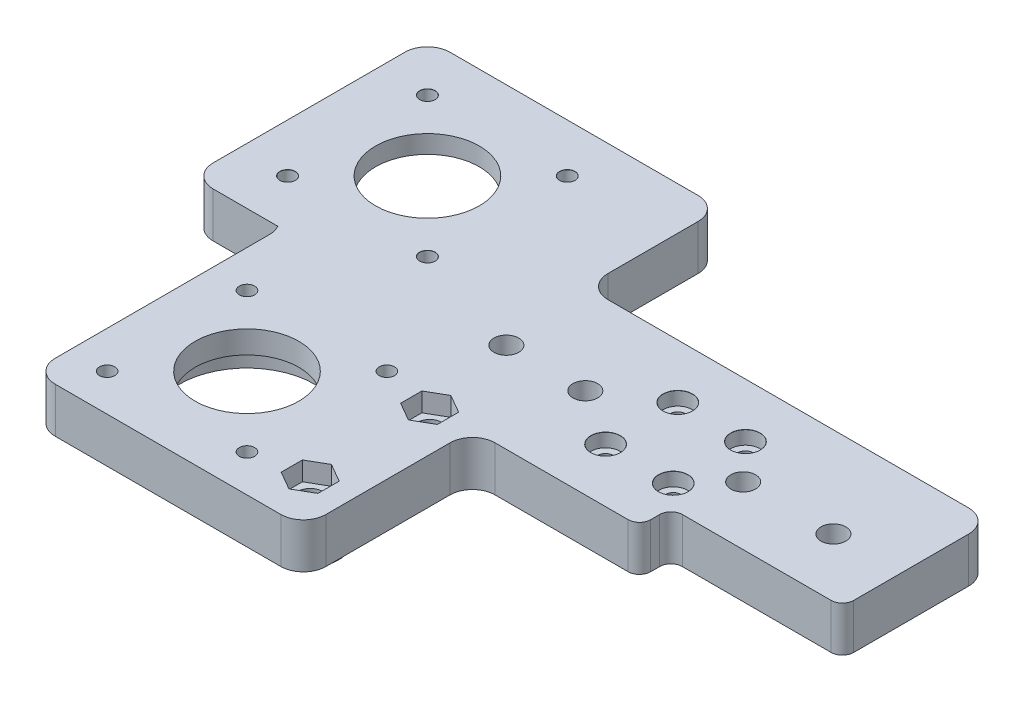
from build123d import *

# Parameters (mm, degrees)
BOSS_EXTRUDE1_DEPTH            = 10
FILLET1_R                      = 5
SKETCH3_R                      = 11.5
CUT_EXTRUDE1_DEPTH             = 10
CBORE_FOR_M3_SHCS1_AT_2_COUNT  = 2
CBORE_FOR_M3_SHCS1_AT_2_PITCH  = 43.840620434
CBORE_FOR_M3_SHCS1_AT_3_COUNT  = 2
CBORE_FOR_M3_SHCS1_AT_3_PITCH  = 31
CBORE_FOR_M3_SHCS1_AT_4_COUNT  = 2
CBORE_FOR_M3_SHCS1_AT_4_PITCH  = 31
CBORE_FOR_M3_SHCS2_AT_2_COUNT  = 2
CBORE_FOR_M3_SHCS2_AT_2_PITCH  = 15
CBORE_FOR_M3_SHCS2_AT_3_COUNT  = 2
CBORE_FOR_M3_SHCS2_AT_3_PITCH  = 21.931712199
CBORE_FOR_M3_SHCS2_AT_4_COUNT  = 2
CBORE_FOR_M3_SHCS2_AT_4_PITCH  = 16
CBORE_FOR_M5_SHCS1_AT_2_COUNT  = 2
CBORE_FOR_M5_SHCS1_AT_2_PITCH  = 35
CBORE_FOR_M5_SHCS1_AT_3_COUNT  = 2
CBORE_FOR_M5_SHCS1_AT_3_PITCH  = 52.5
BOSS_EXTRUDE2_DEPTH            = 10
CUT_EXTRUDE2_DEPTH             = 10
FILLET2_R                      = 5
SKETCH16_R                     = 11.5
CUT_EXTRUDE3_DEPTH             = 125.524094054
M3_CLEARANCE_HOLE1_D           = 3.4
M3_CLEARANCE_HOLE1_CSINK_D     = 3.45
M3_CLEARANCE_HOLE1_CSINK_ANGLE = 90
CUT_EXTRUDE4_DEPTH             = 4.2
M5_CLEARANCE_HOLE1_D           = 5.5
M5_CLEARANCE_HOLE1_CSINK_D     = 5.55
M5_CLEARANCE_HOLE1_CSINK_ANGLE = 90
SKETCH25_R                     = 15
CUT_EXTRUDE6_DEPTH             = 5
BOSS_EXTRUDE3_START            = 2.9
SKETCH26_R                     = 6.25
SKETCH26_R_2                   = 2.75
BOSS_EXTRUDE3_DEPTH            = 2.9
CUT_EXTRUDE7_DEPTH             = 10
FILLET3_R                      = 5
CUT_EXTRUDE9_START             = -10
CUT_EXTRUDE9_DEPTH             = 6
BOSS_EXTRUDE5_DEPTH            = 10
FILLET4_R                      = 5
BOSS_EXTRUDE6_START            = -10
BOSS_EXTRUDE6_DEPTH            = 10
FILLET5_R                      = 5
SKETCH38_W                     = 6
SKETCH38_H                     = 16.5
SKETCH38_W_2                   = 16.5
SKETCH38_H_2                   = 6
BOSS_EXTRUDE7_DEPTH            = 21
FILLET6_R                      = 1
SKETCH39_R                     = 1.1
CUT_EXTRUDE10_DEPTH            = 3
CUT_EXTRUDE11_START            = -14
CUT_EXTRUDE11_DEPTH            = 14
SKETCH43_R                     = 1.15
CUT_EXTRUDE12_DEPTH            = 3
CUT_EXTRUDE13_DEPTH            = 151.950322954
FILLET7_R                      = 2.5


with BuildPart() as part:
    # Sketch1 → Boss-Extrude1 (new body)
    with BuildSketch(Plane(origin=(0, 0, 0), x_dir=(1, 0, 0), z_dir=(0, 1, 0))):
        Polygon((0, 67.5), (0, -47.5), (60, -47.5), (60, -10), (110, -10), (110, 30), (60, 30), (60, 67.5), align=None)
    extrude(amount=BOSS_EXTRUDE1_DEPTH)

    # Fillet1
    fillet1_edges = [part.edges().sort_by_distance(p)[0] for p in [
        (60, 5, -30),
        (110, 5, -30),
        (110, 5, 10),
        (60, 5, 47.5),
        (0, 5, 47.5),
        (0, 5, -67.5),
        (60, 5, -67.5),
    ]]
    fillet(fillet1_edges, radius=FILLET1_R)

    # Sketch3 → Cut-Extrude1 (cut)
    with BuildSketch(Plane(origin=(0, 10, 0), x_dir=(1, 0, 0), z_dir=(0, 1, 0))):
        with Locations(Location((23.75, -23.75, 0), (0, 0, 270))):
            Circle(SKETCH3_R)
    extrude(amount=-CUT_EXTRUDE1_DEPTH, mode=Mode.SUBTRACT)

    # Sketch6 → CBORE for M3 SHCS1 (revolve, cut)
    with BuildSketch(Plane(origin=(39.25, 0, 8.25), x_dir=(0, 0, -1), z_dir=(1, 0, 0))):
        Polygon((0, 0), (0, 10), (1.7, 10), (1.7, 3), (3.25, 3), (3.25, 0.025), (3.275, 0), align=None)
    cbore_for_m3_shcs1 = revolve(axis=Axis((39.25, -6.35, 8.25), (0, 1, 0)), mode=Mode.SUBTRACT)

    # CBORE for M3 SHCS1 at 2: CBORE for M3 SHCS1 ×2
    with Locations(*[Vector(-0.7071067811865478, 0, 0.7071067811865474) * (i * CBORE_FOR_M3_SHCS1_AT_2_PITCH) for i in range(1, CBORE_FOR_M3_SHCS1_AT_2_COUNT)]):
        add(cbore_for_m3_shcs1, mode=Mode.SUBTRACT)

    # CBORE for M3 SHCS1 at 3: CBORE for M3 SHCS1 ×2
    with Locations(*[(-i * CBORE_FOR_M3_SHCS1_AT_3_PITCH, 0, 0) for i in range(1, CBORE_FOR_M3_SHCS1_AT_3_COUNT)]):
        add(cbore_for_m3_shcs1, mode=Mode.SUBTRACT)

    # CBORE for M3 SHCS1 at 4: CBORE for M3 SHCS1 ×2
    with Locations(*[(0, 0, i * CBORE_FOR_M3_SHCS1_AT_4_PITCH) for i in range(1, CBORE_FOR_M3_SHCS1_AT_4_COUNT)]):
        add(cbore_for_m3_shcs1, mode=Mode.SUBTRACT)

    # Sketch9 → CBORE for M3 SHCS2 (revolve, cut)
    with BuildSketch(Plane(origin=(77.5, 10, -18), x_dir=(0, 0, 1), z_dir=(1, 0, 0))):
        Polygon((0, 0), (0, 10), (1.7, 10), (1.7, 3), (3.25, 3), (3.25, 0.025), (3.275, 0), align=None)
    cbore_for_m3_shcs2 = revolve(axis=Axis((77.5, 16.35, -18), (0, -1, 0)), mode=Mode.SUBTRACT)

    # CBORE for M3 SHCS2 at 2: CBORE for M3 SHCS2 ×2
    with Locations(*[(i * CBORE_FOR_M3_SHCS2_AT_2_PITCH, 0, 0) for i in range(1, CBORE_FOR_M3_SHCS2_AT_2_COUNT)]):
        add(cbore_for_m3_shcs2, mode=Mode.SUBTRACT)

    # CBORE for M3 SHCS2 at 3: CBORE for M3 SHCS2 ×2
    with Locations(*[Vector(0.6839411288813299, 0, 0.729537204140085) * (i * CBORE_FOR_M3_SHCS2_AT_3_PITCH) for i in range(1, CBORE_FOR_M3_SHCS2_AT_3_COUNT)]):
        add(cbore_for_m3_shcs2, mode=Mode.SUBTRACT)

    # CBORE for M3 SHCS2 at 4: CBORE for M3 SHCS2 ×2
    with Locations(*[(0, 0, i * CBORE_FOR_M3_SHCS2_AT_4_PITCH) for i in range(1, CBORE_FOR_M3_SHCS2_AT_4_COUNT)]):
        add(cbore_for_m3_shcs2, mode=Mode.SUBTRACT)

    # Sketch12 → CBORE for M5 SHCS1 (revolve, cut)
    with BuildSketch(Plane(origin=(100, 0, -10), x_dir=(0, 0, -1), z_dir=(1, 0, 0))):
        Polygon((0, 0), (0, 10), (2.75, 10), (2.75, 5), (5, 5), (5, 0.025), (5.025, 0), align=None)
    cbore_for_m5_shcs1 = revolve(axis=Axis((100, -6.35, -10), (0, 1, 0)), mode=Mode.SUBTRACT)

    # CBORE for M5 SHCS1 at 2: CBORE for M5 SHCS1 ×2
    with Locations(*[(-i * CBORE_FOR_M5_SHCS1_AT_2_PITCH, 0, 0) for i in range(1, CBORE_FOR_M5_SHCS1_AT_2_COUNT)]):
        add(cbore_for_m5_shcs1, mode=Mode.SUBTRACT)

    # CBORE for M5 SHCS1 at 3: CBORE for M5 SHCS1 ×2
    with Locations(*[(-i * CBORE_FOR_M5_SHCS1_AT_3_PITCH, 0, 0) for i in range(1, CBORE_FOR_M5_SHCS1_AT_3_COUNT)]):
        add(cbore_for_m5_shcs1, mode=Mode.SUBTRACT)

    # Sketch14 → Boss-Extrude2 (add)
    with BuildSketch(Plane(origin=(0, 10, 0), x_dir=(1, 0, 0), z_dir=(0, 1, 0))):
        with BuildLine():
            Line((0, 10), (-17.5, 10))
            Line((-17.5, 10), (-17.5, 67.5))
            Line((-17.5, 67.5), (5, 67.5))
            ThreePointArc((5, 67.5), (1.464466094, 66.035533906), (0, 62.5))
            Line((0, 62.5), (0, 10))
        make_face()
    extrude(amount=-BOSS_EXTRUDE2_DEPTH)

    # Sketch15 → Cut-Extrude2 (cut)
    with BuildSketch(Plane(origin=(0, 10, 0), x_dir=(1, 0, 0), z_dir=(0, 1, 0))):
        with BuildLine():
            Line((-17.5, 67.5), (55, 67.5))
            ThreePointArc((55, 67.5), (58.535533906, 66.035533906), (60, 62.5))
            Line((60, 62.5), (60, 57.5))
            Line((60, 57.5), (-17.5, 57.5))
            Line((-17.5, 57.5), (-17.5, 67.5))
        make_face()
    extrude(amount=-CUT_EXTRUDE2_DEPTH, mode=Mode.SUBTRACT)

    # Fillet2
    fillet2_edges = [part.edges().sort_by_distance(p)[0] for p in [
        (0, 5, -10),
        (-17.5, 5, -10),
        (-17.5, 5, -57.5),
        (60, 5, -57.5),
    ]]
    fillet(fillet2_edges, radius=FILLET2_R)

    # Sketch16 → Cut-Extrude3 (cut, through all)
    with BuildSketch(Plane(origin=(0, 10, 0), x_dir=(1, 0, 0), z_dir=(0, 1, 0))):
        with Locations(Location((6.25, 33.75, 0), (0, 0, 270))):
            Circle(SKETCH16_R)
    extrude(amount=-CUT_EXTRUDE3_DEPTH, mode=Mode.SUBTRACT)

    # M3 Clearance Hole1 (through all)
    with Locations(Plane(origin=(0, 10, 0), x_dir=(1, 0, 0), z_dir=(0, 1, 0))):
        with Locations((-9.25, 49.25), (21.75, 49.25), (21.75, 18.25), (-9.25, 18.25)):
            CounterSinkHole(M3_CLEARANCE_HOLE1_D / 2, M3_CLEARANCE_HOLE1_CSINK_D / 2, counter_sink_angle=M3_CLEARANCE_HOLE1_CSINK_ANGLE)

    # Sketch20 → Cut-Extrude4 (cut)
    with BuildSketch(Plane(origin=(0, 10, 0), x_dir=(1, 0, 0), z_dir=(0, 1, 0))):
        Polygon((55.075, -8.157297653), (51, -5.804595306), (46.925, -8.157297653), (46.925, -12.862702347), (51, -15.215404694), (55.075, -12.862702347), align=None)
        Polygon((51, -32.284595306), (46.925, -34.637297653), (46.925, -39.342702347), (51, -41.695404694), (55.075, -39.342702347), (55.075, -34.637297653), align=None)
    extrude(amount=-CUT_EXTRUDE4_DEPTH, mode=Mode.SUBTRACT)

    # M5 Clearance Hole1 (through all)
    with Locations(Plane(origin=(0, 10, 0), x_dir=(1, 0, 0), z_dir=(0, 1, 0))):
        with Locations((51, -10.51), (51, -36.99)):
            CounterSinkHole(M5_CLEARANCE_HOLE1_D / 2, M5_CLEARANCE_HOLE1_CSINK_D / 2, counter_sink_angle=M5_CLEARANCE_HOLE1_CSINK_ANGLE)

    # Sketch25 → Cut-Extrude6 (cut)
    with BuildSketch(Plane.XZ):
        with Locations(Location((23.75, 23.75, 0), (0, 0, 270))):
            Circle(SKETCH25_R)
    extrude(amount=-CUT_EXTRUDE6_DEPTH, mode=Mode.SUBTRACT)

    # Sketch26 → Boss-Extrude3 (add)
    # profile 1 of 2: a face of its own
    with BuildSketch(Plane.XZ.offset(BOSS_EXTRUDE3_START)):
        with Locations(Location((51, 36.99, 0), (0, 0, 90))):
            Circle(SKETCH26_R)
        with Locations(Location((51, 36.99, 0), (0, 0, 90))):
            Circle(SKETCH26_R_2, mode=Mode.SUBTRACT)
    # profile 2 of 2: a face of its own
    with BuildSketch(Plane.XZ.offset(BOSS_EXTRUDE3_START)):
        with Locations(Location((51, 10.51, 0), (0, 0, 90))):
            Circle(SKETCH26_R)
        with Locations(Location((51, 10.51, 0), (0, 0, 90))):
            Circle(SKETCH26_R_2, mode=Mode.SUBTRACT)
    extrude(amount=-BOSS_EXTRUDE3_DEPTH)

    # Sketch27 → Cut-Extrude7 (cut)
    with BuildSketch(Plane(origin=(0, 10, 0), x_dir=(1, 0, 0), z_dir=(0, 1, 0))):
        with BuildLine():
            Line((65, 30), (45, 30))
            Line((45, 30), (45, 57.5))
            Line((45, 57.5), (55, 57.5))
            ThreePointArc((55, 57.5), (58.535533906, 56.035533906), (60, 52.5))
            Line((60, 52.5), (60, 35))
            ThreePointArc((60, 35), (61.464466094, 31.464466094), (65, 30))
        make_face()
    extrude(amount=-CUT_EXTRUDE7_DEPTH, mode=Mode.SUBTRACT)

    # Fillet3
    fillet3_edges = [part.edges().sort_by_distance(p)[0] for p in [
        (60, 5, 10),
        (45, 5, -30),
        (45, 5, -57.5),
    ]]
    fillet(fillet3_edges, radius=FILLET3_R)

    # Sketch31 → Cut-Extrude9 (cut)
    with BuildSketch(Plane(origin=(0, 10, 0), x_dir=(1, 0, 0), z_dir=(0, 1, 0)).offset(CUT_EXTRUDE9_START)):
        with BuildLine():
            Line((-15.5, 49.835786438), (-15.5, 17.664213562))
            ThreePointArc((-15.5, 17.664213562), (-15.347759065, 16.898846698), (-14.914213562, 16.25))
            Line((-14.914213562, 16.25), (-11.25, 12.585786438))
            ThreePointArc((-11.25, 12.585786438), (-10.601153302, 12.152240935), (-9.835786438, 12))
            Line((-9.835786438, 12), (22.335786438, 12))
            ThreePointArc((22.335786438, 12), (23.101153302, 12.152240935), (23.75, 12.585786438))
            Line((23.75, 12.585786438), (27.414213562, 16.25))
            ThreePointArc((27.414213562, 16.25), (27.847759065, 16.898846698), (28, 17.664213562))
            Line((28, 17.664213562), (28, 49.835786438))
            ThreePointArc((28, 49.835786438), (27.847759065, 50.601153302), (27.414213562, 51.25))
            Line((27.414213562, 51.25), (23.75, 54.914213562))
            ThreePointArc((23.75, 54.914213562), (23.101153302, 55.347759065), (22.335786438, 55.5))
            Line((22.335786438, 55.5), (-9.835786438, 55.5))
            ThreePointArc((-9.835786438, 55.5), (-10.601153302, 55.347759065), (-11.25, 54.914213562))
            Line((-11.25, 54.914213562), (-14.914213562, 51.25))
            ThreePointArc((-14.914213562, 51.25), (-15.347759065, 50.601153302), (-15.5, 49.835786438))
        make_face()
    extrude(amount=CUT_EXTRUDE9_DEPTH, mode=Mode.SUBTRACT)

    # Sketch32 → Boss-Extrude5 (add)
    with BuildSketch(Plane.XZ):
        with BuildLine():
            Line((-20, -7.5), (-20, -60))
            Line((-20, -60), (45, -60))
            Line((45, -60), (45, -52.5))
            ThreePointArc((45, -52.5), (43.535533906, -56.035533906), (40, -57.5))
            Line((40, -57.5), (-12.5, -57.5))
            ThreePointArc((-12.5, -57.5), (-16.035533906, -56.035533906), (-17.5, -52.5))
            Line((-17.5, -52.5), (-17.5, -15))
            ThreePointArc((-17.5, -15), (-16.035533906, -11.464466094), (-12.5, -10))
            Line((-12.5, -10), (-5, -10))
            ThreePointArc((-5, -10), (-2.5, -9.330127019), (-0.669872981, -7.5))
            Line((-0.669872981, -7.5), (-20, -7.5))
        make_face()
    extrude(amount=-BOSS_EXTRUDE5_DEPTH)

    # Fillet4
    fillet4_edges = [part.edges().sort_by_distance(p)[0] for p in [
        (-20, 5, -7.5),
        (-20, 5, -60),
        (45, 5, -60),
    ]]
    fillet(fillet4_edges, radius=FILLET4_R)

    # Sketch33 → Boss-Extrude6 (add)
    with BuildSketch(Plane.XZ.offset(BOSS_EXTRUDE6_START)):
        with BuildLine():
            Line((105, -30), (135, -30))
            Line((135, -30), (135, 10))
            Line((135, 10), (105, 10))
            ThreePointArc((105, 10), (108.535533906, 8.535533906), (110, 5))
            Line((110, 5), (110, -25))
            ThreePointArc((110, -25), (108.535533906, -28.535533906), (105, -30))
        make_face()
    extrude(amount=BOSS_EXTRUDE6_DEPTH)

    # Sketch36 → CBORE for M5 SHCS2 (revolve, cut)
    with BuildSketch(Plane(origin=(120, 0, -10.002889337), x_dir=(0, 0, -1), z_dir=(1, 0, 0))):
        Polygon((0, 0), (0, 10), (2.75, 10), (2.75, 5), (5, 5), (5, 0.020977491), (5.025, 0), align=None)
    revolve(axis=Axis((120, -6.35, -10.002889337), (0, 1, 0)), mode=Mode.SUBTRACT)

    # Fillet5
    fillet5_edges = [part.edges().sort_by_distance(p)[0] for p in [
        (135, 5, -30),
        (135, 5, 10),
    ]]
    fillet(fillet5_edges, radius=FILLET5_R)

    # Sketch38 → Boss-Extrude7 (add)
    with BuildSketch(Plane.XZ):
        with Locations((71, -21.75)):
            Rectangle(SKETCH38_W, SKETCH38_H)
        with Locations((104.25, -27)):
            Rectangle(SKETCH38_W_2, SKETCH38_H_2)
    extrude(amount=BOSS_EXTRUDE7_DEPTH)

    # Fillet6
    # the kernel refuses this fillet: 1 mm, written as the material it takes off along each edge
    with BuildSketch(Plane(origin=(68, 0, -13.5), x_dir=(0, 0, -1), z_dir=(0, -1, 0)), Plane(origin=(68, 0, -30), x_dir=(1, 0, 0), z_dir=(0, -1, 0)), Plane(origin=(74, 0, -13.5), x_dir=(-1, 0, 0), z_dir=(0, -1, 0)), Plane(origin=(96, 0, -24), x_dir=(0, 0, -1), z_dir=(0, -1, 0)), Plane(origin=(96, 0, -30), x_dir=(1, 0, 0), z_dir=(0, -1, 0)), Plane(origin=(112.5, 0, -24), x_dir=(-1, 0, 0), z_dir=(0, -1, 0))) as fillet6_piece_1:
        with BuildLine():
            CenterArc((FILLET6_R, FILLET6_R), FILLET6_R, 180, 90)
            Line((0, FILLET6_R), (0, 0))
            Line((0, 0), (FILLET6_R, 0))
        make_face()
    extrude(amount=23.5, mode=Mode.SUBTRACT)
    with BuildSketch(Plane(origin=(74, 0, -30), x_dir=(-1, 0, 0), z_dir=(0, -1, 0)), Plane(origin=(112.5, 0, -30), x_dir=(-1, 0, 0), z_dir=(0, -1, 0))) as fillet6_piece_2:
        with BuildLine():
            CenterArc((FILLET6_R, -FILLET6_R), FILLET6_R, 90, 90)
            Line((0, -FILLET6_R), (0, 0))
            Line((0, 0), (FILLET6_R, 0))
        make_face()
    extrude(amount=23.5, mode=Mode.SUBTRACT)

    # Sketch39 → Cut-Extrude10 (cut)
    with BuildSketch(Plane.ZY.offset(-68)):
        with Locations((-19.79, -6.5)):
            Circle(SKETCH39_R)
        with Locations((-19.79, -16)):
            Circle(SKETCH39_R)
    extrude(amount=-CUT_EXTRUDE10_DEPTH, mode=Mode.SUBTRACT)

    # Sketch42 → Cut-Extrude11 (cut)
    with BuildSketch(Plane.XZ.offset(21).offset(CUT_EXTRUDE11_START)):
        with BuildLine():
            Line((96, -25), (96, -29))
            ThreePointArc((96, -29), (96.292893219, -29.707106781), (97, -30))
            Line((97, -30), (111.5, -30))
            ThreePointArc((111.5, -30), (112.207106781, -29.707106781), (112.5, -29))
            Line((112.5, -29), (112.5, -25))
            ThreePointArc((112.5, -25), (112.207106781, -24.292893219), (111.5, -24))
            Line((111.5, -24), (97, -24))
            ThreePointArc((97, -24), (96.292893219, -24.292893219), (96, -25))
        make_face()
    extrude(amount=CUT_EXTRUDE11_DEPTH, mode=Mode.SUBTRACT)

    # Sketch43 → Cut-Extrude12 (cut)
    with BuildSketch(Plane(origin=(0, 0, -30), x_dir=(-1, 0, 0), z_dir=(0, 0, -1))):
        with Locations((-98.9, 8)):
            Circle(SKETCH43_R)
        with Locations((-98.9, -1.5)):
            Circle(SKETCH43_R)
    extrude(amount=-CUT_EXTRUDE12_DEPTH, mode=Mode.SUBTRACT)

    # Sketch44 → Cut-Extrude13 (cut, through all)
    with BuildSketch(Plane(origin=(0, 10, 0), x_dir=(1, 0, 0), z_dir=(0, 1, 0))):
        with BuildLine():
            Line((130, -10), (97, -10))
            Line((97, -10), (97, -3))
            Line((97, -3), (135, -3))
            Line((135, -3), (135, -5))
            ThreePointArc((135, -5), (133.535533906, -8.535533906), (130, -10))
        make_face()
    extrude(amount=-CUT_EXTRUDE13_DEPTH, mode=Mode.SUBTRACT)

    # Fillet7
    fillet7_edges = [part.edges().sort_by_distance(p)[0] for p in [
        (97, 5, 10),
        (97, 5, 3),
        (135, 5, 3),
    ]]
    fillet(fillet7_edges, radius=FILLET7_R)


solid = part.part
